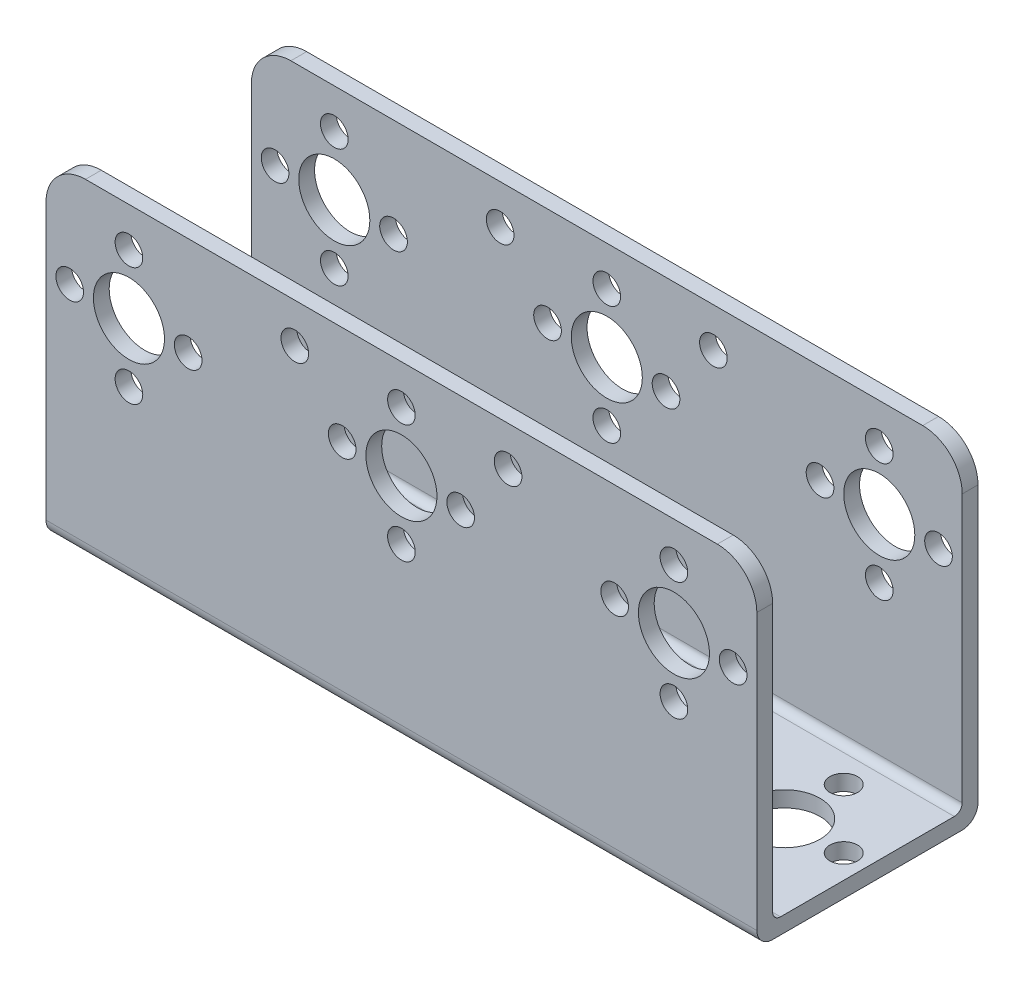
from build123d import *

# Parameters (mm, degrees)
ESTRUSIONE_ESTRUSIONE1_DEPTH = 2
SCHIZZO2_W                   = 90
SCHIZZO2_H                   = 28
ESTRUSIONE_ESTRUSIONE2_DEPTH = 2
ESTRUSIONE_ESTRUSIONE3_START = 2
ESTRUSIONE_ESTRUSIONE3_DEPTH = 2
SCHIZZO5_R                   = 4.5
SCHIZZO5_R_2                 = 1.75
TAGLIO_ESTRUSIONE1_DEPTH     = 104.132432046
RACCORDO1_R                  = 2
RACCORDO2_R                  = 2
RACCORDO3_R                  = 1
RACCORDO4_R                  = 1
SCHIZZO6_R                   = 4.5
SCHIZZO6_R_2                 = 1.75
TAGLIO_ESTRUSIONE2_DEPTH     = 104.132432046


with BuildPart() as part:
    # Schizzo1 → Estrusione-Estrusione1 (new body)
    with BuildSketch(Plane.XY):
        with BuildLine():
            Line((0, 0), (90, 0))
            Line((90, 0), (90, 36.860465116))
            ThreePointArc((90, 36.860465116), (88.535533906, 40.395999022), (85, 41.860465116))
            Line((85, 41.860465116), (5, 41.860465116))
            ThreePointArc((5, 41.860465116), (1.464466094, 40.395999022), (0, 36.860465116))
            Line((0, 36.860465116), (0, 0))
        make_face()
    extrude(amount=-ESTRUSIONE_ESTRUSIONE1_DEPTH)

    # Schizzo2 → Estrusione-Estrusione2 (add)
    with BuildSketch(Plane(origin=(0, 0, 0), x_dir=(1, 0, 0), z_dir=(0, 1, 0))):
        with Locations((45, 14)):
            Rectangle(SCHIZZO2_W, SCHIZZO2_H)
    extrude(amount=ESTRUSIONE_ESTRUSIONE2_DEPTH)

    # Schizzo4 → Estrusione-Estrusione3 (add)
    with BuildSketch(Plane.XY.offset(-28).offset(ESTRUSIONE_ESTRUSIONE3_START)):
        with BuildLine():
            Line((90, 0), (90, 36.860465116))
            ThreePointArc((90, 36.860465116), (88.535533906, 40.395999022), (85, 41.860465116))
            Line((85, 41.860465116), (5, 41.860465116))
            ThreePointArc((5, 41.860465116), (1.464466094, 40.395999022), (0, 36.860465116))
            Line((0, 36.860465116), (0, 0))
            Line((0, 0), (90, 0))
        make_face()
    extrude(amount=-ESTRUSIONE_ESTRUSIONE3_DEPTH)

    # Schizzo5 → Taglio-Estrusione1 (cut, through all)
    with BuildSketch(Plane.XY):
        with Locations((10.5, 29.360465116)):
            Circle(SCHIZZO5_R)
        with Locations((45, 29.360465116)):
            Circle(SCHIZZO5_R)
        with Locations((79.5, 29.360465116)):
            Circle(SCHIZZO5_R)
        with Locations((10.5, 36.860465116)):
            Circle(SCHIZZO5_R_2)
        with Locations((3, 29.360465116)):
            Circle(SCHIZZO5_R_2)
        with Locations((10.5, 21.860465116)):
            Circle(SCHIZZO5_R_2)
        with Locations((18, 29.360465116)):
            Circle(SCHIZZO5_R_2)
        with Locations((37.5, 29.360465116)):
            Circle(SCHIZZO5_R_2)
        with Locations((45, 36.860465116)):
            Circle(SCHIZZO5_R_2)
        with Locations((79.5, 36.860465116)):
            Circle(SCHIZZO5_R_2)
        with Locations((72, 29.360465116)):
            Circle(SCHIZZO5_R_2)
        with Locations((45, 21.860465116)):
            Circle(SCHIZZO5_R_2)
        with Locations((79.5, 21.860465116)):
            Circle(SCHIZZO5_R_2)
        with Locations((87, 29.360465116)):
            Circle(SCHIZZO5_R_2)
        with Locations((31.5, 36.860465116)):
            Circle(SCHIZZO5_R_2)
        with Locations((58.5, 36.860465116)):
            Circle(SCHIZZO5_R_2)
        with Locations((52.5, 29.360465116)):
            Circle(SCHIZZO5_R_2)
    extrude(amount=-TAGLIO_ESTRUSIONE1_DEPTH, mode=Mode.SUBTRACT)

    # Raccordo1
    raccordo1_edges = [part.edges().sort_by_distance(p)[0] for p in [
        (45, 0, -28),
    ]]
    fillet(raccordo1_edges, radius=RACCORDO1_R)

    # Raccordo2
    raccordo2_edges = [part.edges().sort_by_distance(p)[0] for p in [
        (45, 0, 0),
    ]]
    fillet(raccordo2_edges, radius=RACCORDO2_R)

    # Raccordo3
    raccordo3_edges = [part.edges().sort_by_distance(p)[0] for p in [
        (45, 2, -2),
    ]]
    fillet(raccordo3_edges, radius=RACCORDO3_R)

    # Raccordo4
    raccordo4_edges = [part.edges().sort_by_distance(p)[0] for p in [
        (45, 2, -26),
    ]]
    fillet(raccordo4_edges, radius=RACCORDO4_R)

    # Schizzo6 → Taglio-Estrusione2 (cut, through all)
    with BuildSketch(Plane(origin=(0, 0, 0), x_dir=(1, 0, 0), z_dir=(0, 1, 0))):
        with Locations((45, 14)):
            Circle(SCHIZZO6_R)
        with Locations((10.5, 14)):
            Circle(SCHIZZO6_R)
        with Locations((79.5, 14)):
            Circle(SCHIZZO6_R)
        with Locations((10.5, 21.5)):
            Circle(SCHIZZO6_R_2)
        with Locations((3, 14)):
            Circle(SCHIZZO6_R_2)
        with Locations((10.5, 6.5)):
            Circle(SCHIZZO6_R_2)
        with Locations((18, 14)):
            Circle(SCHIZZO6_R_2)
        with Locations((37.5, 14)):
            Circle(SCHIZZO6_R_2)
        with Locations((45, 21.5)):
            Circle(SCHIZZO6_R_2)
        with Locations((79.5, 21.5)):
            Circle(SCHIZZO6_R_2)
        with Locations((79.5, 6.5)):
            Circle(SCHIZZO6_R_2)
        with Locations((45, 6.5)):
            Circle(SCHIZZO6_R_2)
        with Locations((52.5, 14)):
            Circle(SCHIZZO6_R_2)
        with Locations((87, 14)):
            Circle(SCHIZZO6_R_2)
        with Locations((72, 14)):
            Circle(SCHIZZO6_R_2)
    extrude(amount=TAGLIO_ESTRUSIONE2_DEPTH, mode=Mode.SUBTRACT)


solid = part.part
